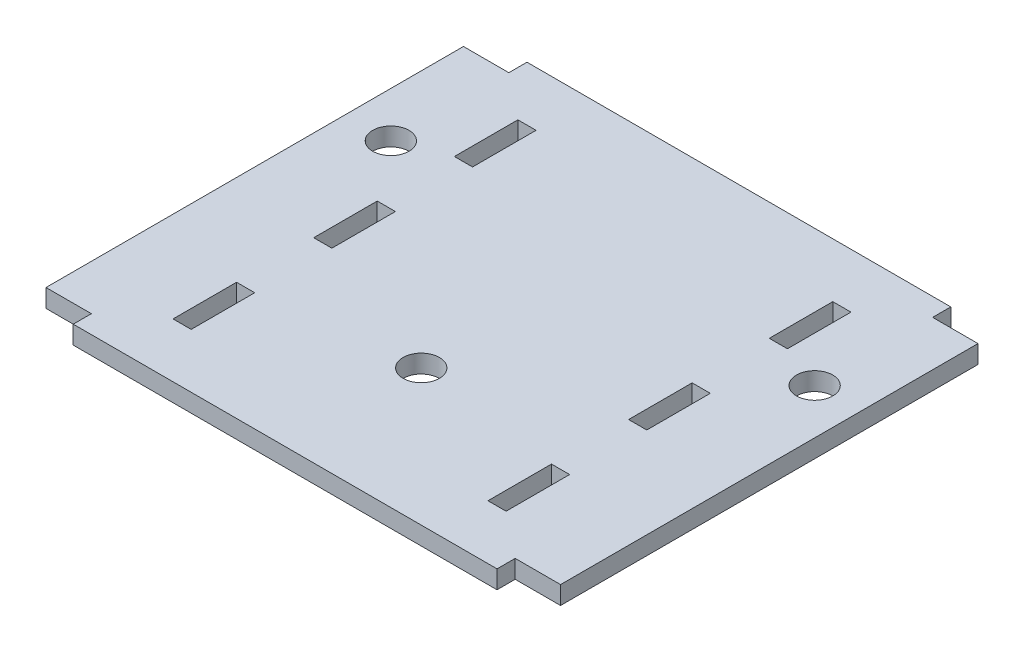
from build123d import *

# Parameters (mm, degrees)
SKETCH1_W           = 2
SKETCH1_H           = 7
SKETCH1_R           = 2
BOSS_EXTRUDE1_DEPTH = 2
SKETCH2_W           = 23.15
SKETCH2_H           = 50
CUT_EXTRUDE1_DEPTH  = 10


with BuildPart() as part:
    # Sketch1 → Boss-Extrude1 (new body)
    with BuildSketch(Plane(origin=(0, 0, 0), x_dir=(1, 0, 0), z_dir=(0, 1, 0))):
        Polygon((-47.649453113, 2.019339096), (-70.799453113, 2.019339096), (-70.799453113, -47.980660904), (-47.649453113, -47.980660904), (-47.649453113, -45.980660904), (-42.649453113, -45.980660904), (-42.649453113, -47.980660904), (4.050546887, -47.980660904), (4.050546887, -45.980660904), (9.050546887, -45.980660904), (9.050546887, -47.980660904), (32.200546887, -47.980660904), (32.200546887, 2.019339096), (9.050546887, 2.019339096), (9.050546887, 0.019339096), (4.050546887, 0.019339096), (4.050546887, 2.019339096), (-42.649453113, 2.019339096), (-42.649453113, 0.019339096), (-47.649453113, 0.019339096), align=None)
        with Locations((-36.649453113, -38.480660904)):
            Rectangle(SKETCH1_W, SKETCH1_H, mode=Mode.SUBTRACT)
        with Locations((-1.949453113, -38.480660904)):
            Rectangle(SKETCH1_W, SKETCH1_H, mode=Mode.SUBTRACT)
        with Locations((-19.299453113, -32.980660904)):
            Circle(SKETCH1_R, mode=Mode.SUBTRACT)
        with Locations((-36.649453113, -22.980660904)):
            Rectangle(SKETCH1_W, SKETCH1_H, mode=Mode.SUBTRACT)
        with Locations((-42.649453113, -12.980660904)):
            Circle(SKETCH1_R, mode=Mode.SUBTRACT)
        with Locations((-36.649453113, -7.480660904)):
            Rectangle(SKETCH1_W, SKETCH1_H, mode=Mode.SUBTRACT)
        with Locations((-1.949453113, -22.980660904)):
            Rectangle(SKETCH1_W, SKETCH1_H, mode=Mode.SUBTRACT)
        with Locations((4.050546887, -12.980660904)):
            Circle(SKETCH1_R, mode=Mode.SUBTRACT)
        with Locations((-1.949453113, -7.480660904)):
            Rectangle(SKETCH1_W, SKETCH1_H, mode=Mode.SUBTRACT)
    extrude(amount=BOSS_EXTRUDE1_DEPTH)

    # Sketch2 → Cut-Extrude1 (cut)
    with BuildSketch(Plane(origin=(0, 0, 0), x_dir=(-1, 0, 0), z_dir=(0, -1, 0))):
        with Locations((59.224453113, -22.980660904)):
            Rectangle(SKETCH2_W, SKETCH2_H)
        with Locations((-20.625546887, -22.980660904)):
            Rectangle(SKETCH2_W, SKETCH2_H)
    extrude(amount=-CUT_EXTRUDE1_DEPTH, mode=Mode.SUBTRACT)


solid = part.part
